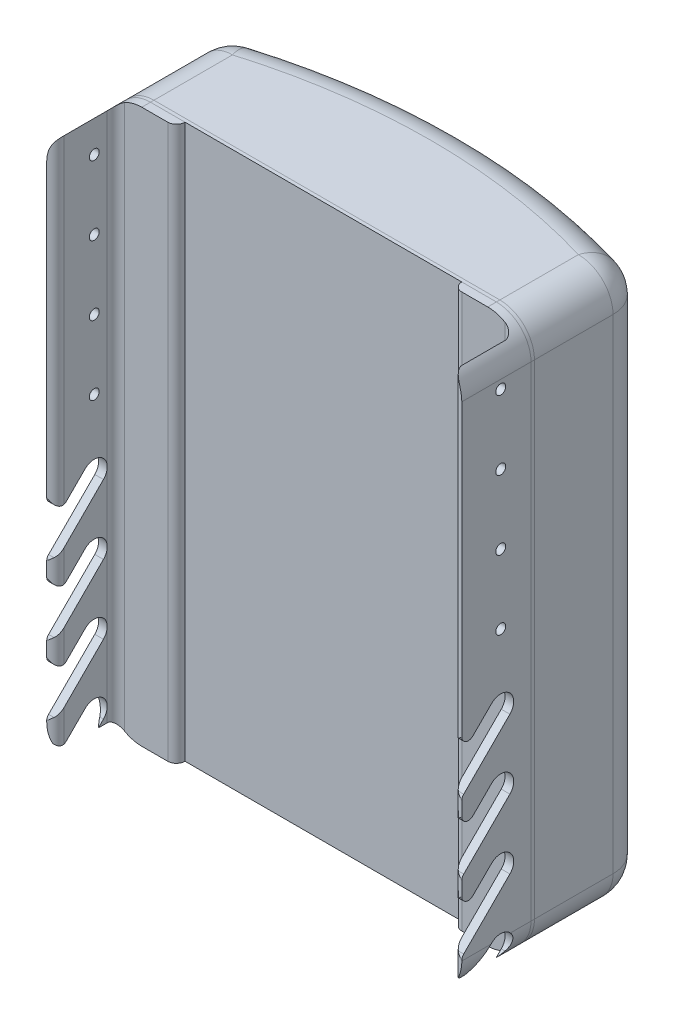
from build123d import *

# Parameters (mm, degrees)
STRUCTURAL_MEMBER1_DEPTH   = 203.2
STRUCTURAL_MEMBER1_2_DEPTH = 203.2
CUT_EXTRUDE1_DEPTH         = 130.515095645
CUT_EXTRUDE1_DEPTH_BACK    = 130.515095645
SKETCH21_R                 = 1.8288
SKETCH21_R_2               = 4.7625
CUT_EXTRUDE2_DEPTH         = 130.515095645
CUT_EXTRUDE2_DEPTH_BACK    = 130.515095645
CUT_EXTRUDE3_DEPTH         = 130.515095645
CUT_EXTRUDE3_DEPTH_BACK    = 130.515095645
SKETCH24_OUTSIDE_W         = 78.454
SKETCH24_OUTSIDE_H         = 256.254
SKETCH25_W                 = 152.4
SKETCH25_H                 = 203.2
BASE_FLANGE1_DEPTH         = 1.27
BOSS_EXTRUDE1_DEPTH        = 101.6
BOSS_EXTRUDE1_DEPTH_BACK   = 101.6
SKETCH30_W                 = 152.4
SKETCH30_H                 = 50.8
CUT_EXTRUDE4_DEPTH         = 224.17698115
FILLET1_R                  = 12.7
CUT_EXTRUDE5_DEPTH         = 138.25991744
CUT_EXTRUDE5_DEPTH_BACK    = 138.25991744
SKETCH32_OUTSIDE_W         = 207.51
SKETCH32_OUTSIDE_H         = 258.31


# Sheet-metal steps are written as plain solids
with BuildPart() as part:
    # Sketch16 → Structural Member1 (new body)
    with BuildSketch(Plane(origin=(-73.025, 101.6, 3.175), x_dir=(1, 0, 0), z_dir=(0, -1, 0))):
        with BuildLine():
            Line((0, 3.175), (0, 19.05))
            ThreePointArc((0, 19.05), (-0.92993597, 21.29506403), (-3.175, 22.225))
            Line((-3.175, 22.225), (-3.175, -3.175))
            Line((-3.175, -3.175), (22.225, -3.175))
            ThreePointArc((22.225, -3.175), (21.29506403, -0.92993597), (19.05, 0))
            Line((19.05, 0), (3.175, 0))
            ThreePointArc((3.175, 0), (0.92993597, 0.92993597), (0, 3.175))
        make_face()
    extrude(amount=STRUCTURAL_MEMBER1_DEPTH)


with BuildPart() as body_2:
    # Sketch16 on segment 2 (carried to segment 2) → Structural Member1 2 (new body)
    with BuildSketch(Plane(origin=(73.025, 101.6, 3.175), x_dir=(0, 0, 1), z_dir=(0, -1, 0))):
        with BuildLine():
            Line((0, 3.175), (0, 19.05))
            ThreePointArc((0, 19.05), (-0.92993597, 21.29506403), (-3.175, 22.225))
            Line((-3.175, 22.225), (-3.175, -3.175))
            Line((-3.175, -3.175), (22.225, -3.175))
            ThreePointArc((22.225, -3.175), (21.29506403, -0.92993597), (19.05, 0))
            Line((19.05, 0), (3.175, 0))
            ThreePointArc((3.175, 0), (0.92993597, 0.92993597), (0, 3.175))
        make_face()
    extrude(amount=STRUCTURAL_MEMBER1_2_DEPTH)


with BuildPart() as cut_extrude1_tool:
    # Sketch21 → Cut-Extrude1 (new, two sides: drawn at the far end of the back side and taken through both)
    with BuildSketch(Plane(origin=(0, 0, 0), x_dir=(0, 0, -1), z_dir=(1, 0, 0)).offset(-CUT_EXTRUDE1_DEPTH_BACK)):
        with Locations((-11.1125, 34.925)):
            Circle(SKETCH21_R)
        with Locations((-11.1125, -92.075)):
            Circle(SKETCH21_R_2)
        with Locations((-11.1125, -66.675)):
            Circle(SKETCH21_R_2)
        with Locations((-11.1125, -41.275)):
            Circle(SKETCH21_R_2)
        with Locations((-11.1125, -15.875)):
            Circle(SKETCH21_R_2)
        with Locations((-11.1125, 60.325)):
            Circle(SKETCH21_R)
        with Locations((-11.1125, 85.725)):
            Circle(SKETCH21_R)
        with Locations((-11.1125, 9.525)):
            Circle(SKETCH21_R)
    extrude(amount=CUT_EXTRUDE1_DEPTH + CUT_EXTRUDE1_DEPTH_BACK)


with BuildPart() as part_1:
    add(part.part)

    # Cut-Extrude1: cut by cut_extrude1_tool
    add(cut_extrude1_tool.part, mode=Mode.SUBTRACT)


with BuildPart() as body_2_1:
    add(body_2.part)

    # Cut-Extrude1: cut by cut_extrude1_tool
    add(cut_extrude1_tool.part, mode=Mode.SUBTRACT)


with BuildPart() as cut_extrude2_tool:
    # Sketch22 → Cut-Extrude2 (new, two sides: drawn at the far end of the back side and taken through both)
    with BuildSketch(Plane(origin=(0, 0, 0), x_dir=(0, 0, -1), z_dir=(1, 0, 0)).offset(-CUT_EXTRUDE2_DEPTH_BACK)):
        with BuildLine():
            Line((-7.744903955, -95.442596045), (-30.195544257, -117.893236348))
            ThreePointArc((-30.195544257, -117.893236348), (-36.930736348, -117.893236348), (-36.930736348, -111.158044257))
            Line((-36.930736348, -111.158044257), (-14.480096045, -88.707403955))
            ThreePointArc((-14.480096045, -88.707403955), (-7.744903955, -88.707403955), (-7.744903955, -95.442596045))
        make_face()
        with BuildLine():
            Line((-7.744903955, -70.042596045), (-30.195544257, -92.493236348))
            ThreePointArc((-30.195544257, -92.493236348), (-36.930736348, -92.493236348), (-36.930736348, -85.758044257))
            Line((-36.930736348, -85.758044257), (-14.480096045, -63.307403955))
            ThreePointArc((-14.480096045, -63.307403955), (-7.744903955, -63.307403955), (-7.744903955, -70.042596045))
        make_face()
        with BuildLine():
            Line((-7.744903955, -44.642596045), (-30.195544257, -67.093236348))
            ThreePointArc((-30.195544257, -67.093236348), (-36.930736348, -67.093236348), (-36.930736348, -60.358044257))
            Line((-36.930736348, -60.358044257), (-14.480096045, -37.907403955))
            ThreePointArc((-14.480096045, -37.907403955), (-7.744903955, -37.907403955), (-7.744903955, -44.642596045))
        make_face()
        with BuildLine():
            Line((-7.744903955, -19.242596045), (-30.195544257, -41.693236348))
            ThreePointArc((-30.195544257, -41.693236348), (-36.930736348, -41.693236348), (-36.930736348, -34.958044257))
            Line((-36.930736348, -34.958044257), (-14.480096045, -12.507403955))
            ThreePointArc((-14.480096045, -12.507403955), (-7.744903955, -12.507403955), (-7.744903955, -19.242596045))
        make_face()
    extrude(amount=CUT_EXTRUDE2_DEPTH + CUT_EXTRUDE2_DEPTH_BACK)


with BuildPart() as part_2:
    add(part_1.part)

    # Cut-Extrude2: cut by cut_extrude2_tool
    add(cut_extrude2_tool.part, mode=Mode.SUBTRACT)


with BuildPart() as body_2_2:
    add(body_2_1.part)

    # Cut-Extrude2: cut by cut_extrude2_tool
    add(cut_extrude2_tool.part, mode=Mode.SUBTRACT)


with BuildPart() as cut_extrude3_tool:
    # Sketch24 outside → Cut-Extrude3 (new, two sides: drawn at the far end of the back side and taken through both)
    with BuildSketch(Plane(origin=(0, 0, 0), x_dir=(0, 0, -1), z_dir=(1, 0, 0)).offset(-CUT_EXTRUDE3_DEPTH_BACK)):
        with Locations((-12.7, 0)):
            Rectangle(SKETCH24_OUTSIDE_W, SKETCH24_OUTSIDE_H)
        with BuildLine():
            Line((-7.744903955, -95.442596045), (-9.837259886, -97.534951977))
            ThreePointArc((-9.837259886, -97.534951977), (-10.353450001, -100.130014923), (-8.153461864, -101.6))
            Line((-8.153461864, -101.6), (0, -101.6))
            Line((0, -101.6), (0, 101.6))
            Line((0, 101.6), (-25.4, 101.6))
            Line((-25.4, 101.6), (-25.4, -17.678461864))
            ThreePointArc((-25.4, -17.678461864), (-23.930014923, -19.878450001), (-21.334951977, -19.362259886))
            Line((-21.334951977, -19.362259886), (-14.480096045, -12.507403955))
            ThreePointArc((-14.480096045, -12.507403955), (-7.744903955, -12.507403955), (-7.744903955, -19.242596045))
            Line((-7.744903955, -19.242596045), (-24.702548023, -36.200240114))
            ThreePointArc((-24.702548023, -36.200240114), (-25.218738137, -36.972773213), (-25.4, -37.884038136))
            Line((-25.4, -37.884038136), (-25.4, -43.078461864))
            ThreePointArc((-25.4, -43.078461864), (-23.930014923, -45.278450001), (-21.334951977, -44.762259886))
            Line((-21.334951977, -44.762259886), (-14.480096045, -37.907403955))
            ThreePointArc((-14.480096045, -37.907403955), (-7.744903955, -37.907403955), (-7.744903955, -44.642596045))
            Line((-7.744903955, -44.642596045), (-24.702548023, -61.600240114))
            ThreePointArc((-24.702548023, -61.600240114), (-25.218738137, -62.372773213), (-25.4, -63.284038136))
            Line((-25.4, -63.284038136), (-25.4, -68.478461864))
            ThreePointArc((-25.4, -68.478461864), (-23.930014923, -70.678450001), (-21.334951977, -70.162259886))
            Line((-21.334951977, -70.162259886), (-14.480096045, -63.307403955))
            ThreePointArc((-14.480096045, -63.307403955), (-7.744903955, -63.307403955), (-7.744903955, -70.042596045))
            Line((-7.744903955, -70.042596045), (-24.702548023, -87.000240114))
            ThreePointArc((-24.702548023, -87.000240114), (-25.218738137, -87.772773213), (-25.4, -88.684038136))
            Line((-25.4, -88.684038136), (-25.4, -93.878461864))
            ThreePointArc((-25.4, -93.878461864), (-23.930014923, -96.078450001), (-21.334951977, -95.562259886))
            Line((-21.334951977, -95.562259886), (-14.480096045, -88.707403955))
            ThreePointArc((-14.480096045, -88.707403955), (-7.744903955, -88.707403955), (-7.744903955, -95.442596045))
        make_face(mode=Mode.SUBTRACT)
    extrude(amount=CUT_EXTRUDE3_DEPTH + CUT_EXTRUDE3_DEPTH_BACK)


with BuildPart() as part_3:
    add(part_2.part)

    # Cut-Extrude3: cut by cut_extrude3_tool
    add(cut_extrude3_tool.part, mode=Mode.SUBTRACT)


with BuildPart() as body_2_3:
    add(body_2_2.part)

    # Cut-Extrude3: cut by cut_extrude3_tool
    add(cut_extrude3_tool.part, mode=Mode.SUBTRACT)


with BuildPart() as body_3:
    # Sketch25 → Base-Flange1 (new body)
    with BuildSketch(Plane(origin=(0, 0, 0), x_dir=(-1, 0, 0), z_dir=(0, 0, -1))):
        Rectangle(SKETCH25_W, SKETCH25_H)
    extrude(amount=BASE_FLANGE1_DEPTH)


with BuildPart() as body_4:
    # Sketch30 → Boss-Extrude1 (new, two sides: drawn at the far end of the back side and taken through both)
    with BuildSketch(Plane(origin=(0, 0, 0), x_dir=(1, 0, 0), z_dir=(0, 1, 0)).offset(-BOSS_EXTRUDE1_DEPTH_BACK)):
        with Locations((0, 26.67)):
            Rectangle(SKETCH30_W, SKETCH30_H)
    extrude(amount=BOSS_EXTRUDE1_DEPTH + BOSS_EXTRUDE1_DEPTH_BACK)

    # Sketch31 → Cut-Extrude4 (cut, through all)
    with BuildSketch(Plane(origin=(0, 101.6, 0), x_dir=(1, 0, 0), z_dir=(0, 1, 0))):
        with BuildLine():
            Line((-76.2, 39.37), (-76.2, 64.77))
            Line((-76.2, 64.77), (76.2, 64.77))
            Line((76.2, 64.77), (76.2, 39.37))
            ThreePointArc((76.2, 39.37), (0, 52.07), (-76.2, 39.37))
        make_face()
    extrude(amount=-CUT_EXTRUDE4_DEPTH, mode=Mode.SUBTRACT)

    # Fillet1
    fillet1_edges = [body_4.edges().sort_by_distance(p)[0] for p in [
        (76.2, 101.6, -20.32),
        (76.2, -101.6, -20.32),
        (-76.2, -101.6, -20.32),
        (0, -101.6, -52.07),
        (-76.2, 101.6, -20.32),
        (0, 101.6, -52.07),
        (76.2, 0, -39.37),
        (-76.2, 0, -39.37),
    ]]
    fillet(fillet1_edges, radius=FILLET1_R)


with BuildPart() as cut_extrude5_tool:
    # Sketch32 outside → Cut-Extrude5 (new, two sides: drawn at the far end of the back side and taken through both)
    with BuildSketch(Plane.XY.offset(-CUT_EXTRUDE5_DEPTH_BACK)):
        Rectangle(SKETCH32_OUTSIDE_W, SKETCH32_OUTSIDE_H)
        with BuildLine():
            Line((-76.2, 88.9), (-76.2, -88.9))
            ThreePointArc((-76.2, -88.9), (-72.480256121, -97.880256121), (-63.5, -101.6))
            Line((-63.5, -101.6), (63.5, -101.6))
            ThreePointArc((63.5, -101.6), (72.480256121, -97.880256121), (76.2, -88.9))
            Line((76.2, -88.9), (76.2, 88.9))
            ThreePointArc((76.2, 88.9), (72.480256121, 97.880256121), (63.5, 101.6))
            Line((63.5, 101.6), (-63.5, 101.6))
            ThreePointArc((-63.5, 101.6), (-72.480256121, 97.880256121), (-76.2, 88.9))
        make_face(mode=Mode.SUBTRACT)
    extrude(amount=CUT_EXTRUDE5_DEPTH + CUT_EXTRUDE5_DEPTH_BACK)


with BuildPart() as part_4:
    add(part_3.part)

    # Cut-Extrude5: cut by cut_extrude5_tool
    add(cut_extrude5_tool.part, mode=Mode.SUBTRACT)


with BuildPart() as body_2_4:
    add(body_2_3.part)

    # Cut-Extrude5: cut by cut_extrude5_tool
    add(cut_extrude5_tool.part, mode=Mode.SUBTRACT)


with BuildPart() as body_3_1:
    add(body_3.part)

    # Cut-Extrude5: cut by cut_extrude5_tool
    add(cut_extrude5_tool.part, mode=Mode.SUBTRACT)


solid = Compound([body_4.part, part_4.part, body_2_4.part, body_3_1.part])
